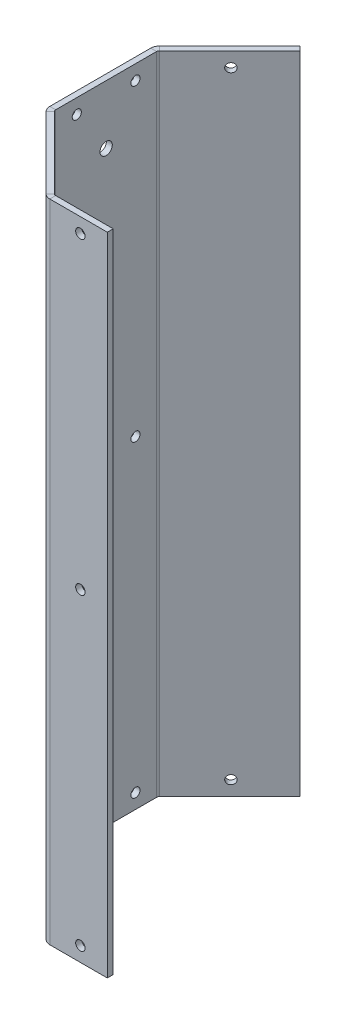
from build123d import *
from build123d.topology import SkipClean

# Parameters (mm, degrees)
EXTRUDE_1_DEPTH             = 220
SKETCH_3_R                  = 1.55
SKETCH_3_R_2                = 2.1
CUT_EXTRUDE_1_DEPTH         = 10
SKETCH_6_R                  = 1.6
CUT_EXTRUDE_2_DEPTH         = 10
CHAMFER_1_SIZE              = 1
CHAMFER_1_SIZE2             = 0.707106781
SHEET_START                 = -114.419250373
SHEET_METAL_2_OUTLINE_W     = 220
SHEET_METAL_2_OUTLINE_H     = 86.5
SHEET_METAL_2_OUTLINE_R     = 1.55
SHEET_METAL_2_OUTLINE_R_2   = 2.1
SHEET_METAL_2_DEPTH         = 26.274603255
SHEET_START_2               = -87.816219993
SHEET_METAL_2_2_OUTLINE_W   = 220
SHEET_METAL_2_2_OUTLINE_H   = 87
SHEET_METAL_2_2_OUTLINE_R   = 1.55
SHEET_METAL_2_2_OUTLINE_R_2 = 2.1
SHEET_METAL_2_2_DEPTH       = 0.483052927
SHEET_START_3               = -89.230433555
SHEET_METAL_2_3_OUTLINE_W   = 220
SHEET_METAL_2_3_OUTLINE_H   = 0.5
SHEET_METAL_2_3_DEPTH       = 21.707106781
SHEET_METAL_2_4_DEPTH       = 220
SHEET_METAL_2_5_DEPTH       = 220
SHEET_START_4               = 44
SHEET_METAL_2_6_OUTLINE_R   = 1.6
SHEET_METAL_2_6_DEPTH       = 0.5
SKETCH_7_R                  = 1.5
CUT_EXTRUDE_3_DEPTH         = 10


with BuildPart() as part:
    # 草图2 → 凸台-拉伸1 (new body)
    with BuildSketch(Plane(origin=(0, 0, 0), x_dir=(1, 0, 0), z_dir=(0, 1, 0))):
        Polygon((-87.523326774, 42.5), (-112.419250373, 17.604076401), (-112.419250373, -17.604076401), (-87.523326774, -42.5), (-67.523326774, -42.5), (-67.523326774, -44), (-88.144647118, -44), (-113.919250373, -18.225396744), (-113.919250373, 18.225396744), (-89.644647118, 42.5), align=None)
    extrude(amount=EXTRUDE_1_DEPTH)

    # Sketch 3 → 切除-拉伸1 (cut)
    with BuildSketch(Plane.ZY.offset(113.919250373)):
        with Locations((-10, 5)):
            Circle(SKETCH_3_R)
        with Locations((10, 5)):
            Circle(SKETCH_3_R)
        with BuildLine():
            ThreePointArc((-8.45, 110), (-10, 111.55), (-11.55, 110))
            Line((-11.55, 110), (-8.45, 110))
        make_face()
        with BuildLine():
            Line((-8.45, 110), (-11.55, 110))
            ThreePointArc((-11.55, 110), (-10, 108.45), (-8.45, 110))
        make_face()
        with BuildLine():
            ThreePointArc((8.45, 110), (10, 108.45), (11.55, 110))
            Line((11.55, 110), (8.45, 110))
        make_face()
        with BuildLine():
            Line((8.45, 110), (11.55, 110))
            ThreePointArc((11.55, 110), (10, 111.55), (8.45, 110))
        make_face()
        with Locations((-10, 215)):
            Circle(SKETCH_3_R)
        with Locations((10, 215)):
            Circle(SKETCH_3_R)
        with Locations((0, 200)):
            Circle(SKETCH_3_R_2)
        with Locations((0, 165)):
            Circle(SKETCH_3_R_2)
        with Locations((0, 55)):
            Circle(SKETCH_3_R_2)
        with Locations((0, 20)):
            Circle(SKETCH_3_R_2)
    extrude(amount=-CUT_EXTRUDE_1_DEPTH, mode=Mode.SUBTRACT)

    # 草图6 → 切除-拉伸2 (cut)
    with BuildSketch(Plane.XY.offset(44)):
        with Locations((-76.693326774, 5)):
            Circle(SKETCH_6_R)
        with Locations((-76.693326774, 110)):
            Circle(SKETCH_6_R)
        with Locations((-76.693326774, 215)):
            Circle(SKETCH_6_R)
    extrude(amount=-CUT_EXTRUDE_2_DEPTH, mode=Mode.SUBTRACT)

    # 倒角1
    chamfer_1_edges = [part.edges().sort_by_distance(p)[0] for p in [
        (-87.523326774, 110, -42.5),
    ]]
    chamfer_1_side = [part.faces().sort_by_distance(p)[0] for p in [
        (-99.971288574, 110, -30.0520382),
    ]]
    chamfer(chamfer_1_edges, length=CHAMFER_1_SIZE, length2=CHAMFER_1_SIZE2, reference=chamfer_1_side[0])

    # Sheet Metal 2: read off the stored shape, not the designer's step
    # Sheet Metal 2 outline → Sheet Metal 2 (add)
    with SkipClean():  # the faces are left unmerged after this step: merging them gives an invalid solid
        with BuildSketch(Plane.YZ.offset(SHEET_START)):
            with Locations((110, 0.75)):
                Rectangle(SHEET_METAL_2_OUTLINE_W, SHEET_METAL_2_OUTLINE_H)
            with Locations((5, -10)):
                Circle(SHEET_METAL_2_OUTLINE_R, mode=Mode.SUBTRACT)
            with Locations((20, 0)):
                Circle(SHEET_METAL_2_OUTLINE_R_2, mode=Mode.SUBTRACT)
            with Locations((55, 0)):
                Circle(SHEET_METAL_2_OUTLINE_R_2, mode=Mode.SUBTRACT)
            with Locations((110, -10)):
                Circle(SHEET_METAL_2_OUTLINE_R, mode=Mode.SUBTRACT)
            with Locations((215, -10)):
                Circle(SHEET_METAL_2_OUTLINE_R, mode=Mode.SUBTRACT)
            with Locations((165, 0)):
                Circle(SHEET_METAL_2_OUTLINE_R_2, mode=Mode.SUBTRACT)
            with Locations((200, 0)):
                Circle(SHEET_METAL_2_OUTLINE_R_2, mode=Mode.SUBTRACT)
            with Locations((5, 10)):
                Circle(SHEET_METAL_2_OUTLINE_R, mode=Mode.SUBTRACT)
            with Locations((110, 10)):
                Circle(SHEET_METAL_2_OUTLINE_R, mode=Mode.SUBTRACT)
            with Locations((215, 10)):
                Circle(SHEET_METAL_2_OUTLINE_R, mode=Mode.SUBTRACT)
        extrude(amount=SHEET_METAL_2_DEPTH)

    # Sheet Metal 2 2 outline → Sheet Metal 2 2 (add)
    with SkipClean():  # the faces are left unmerged after this step: merging them gives an invalid solid
        with BuildSketch(Plane.YZ.offset(SHEET_START_2)):
            with Locations((110, 1)):
                Rectangle(SHEET_METAL_2_2_OUTLINE_W, SHEET_METAL_2_2_OUTLINE_H)
            with Locations((5, -10)):
                Circle(SHEET_METAL_2_2_OUTLINE_R, mode=Mode.SUBTRACT)
            with Locations((20, 0)):
                Circle(SHEET_METAL_2_2_OUTLINE_R_2, mode=Mode.SUBTRACT)
            with Locations((55, 0)):
                Circle(SHEET_METAL_2_2_OUTLINE_R_2, mode=Mode.SUBTRACT)
            with Locations((110, -10)):
                Circle(SHEET_METAL_2_2_OUTLINE_R, mode=Mode.SUBTRACT)
            with Locations((215, -10)):
                Circle(SHEET_METAL_2_2_OUTLINE_R, mode=Mode.SUBTRACT)
            with Locations((165, 0)):
                Circle(SHEET_METAL_2_2_OUTLINE_R_2, mode=Mode.SUBTRACT)
            with Locations((200, 0)):
                Circle(SHEET_METAL_2_2_OUTLINE_R_2, mode=Mode.SUBTRACT)
            with Locations((5, 10)):
                Circle(SHEET_METAL_2_2_OUTLINE_R, mode=Mode.SUBTRACT)
            with Locations((110, 10)):
                Circle(SHEET_METAL_2_2_OUTLINE_R, mode=Mode.SUBTRACT)
            with Locations((215, 10)):
                Circle(SHEET_METAL_2_2_OUTLINE_R, mode=Mode.SUBTRACT)
        extrude(amount=SHEET_METAL_2_2_DEPTH)

    # Sheet Metal 2 3 outline → Sheet Metal 2 3 (add)
    with SkipClean():  # the faces are left unmerged after this step: merging them gives an invalid solid
        with BuildSketch(Plane.YZ.offset(SHEET_START_3)):
            with Locations((110, 44.25)):
                Rectangle(SHEET_METAL_2_3_OUTLINE_W, SHEET_METAL_2_3_OUTLINE_H)
        extrude(amount=SHEET_METAL_2_3_DEPTH)

    # Sheet Metal 2 4 outline → Sheet Metal 2 4 (cut)
    with BuildSketch(Plane(origin=(0, 0, 0), x_dir=(1, 0, 0), z_dir=(0, 1, 0))):
        with BuildLine():
            Line((-87.816219993, 42.5), (-87.816219993, -42.207106781))
            ThreePointArc((-87.816219993, -42.207106781), (-87.593520149, -42.374842797), (-87.333167066, -42.474576765))
            Line((-87.333167066, -42.474576765), (-87.333167066, 42.5))
            Line((-87.333167066, 42.5), (-87.816219993, 42.5))
        make_face()
        with BuildLine():
            Line((-88.144647118, 42.5), (-88.937540337, 42.5))
            Line((-88.937540337, 42.5), (-88.230433555, 41.792893219))
            Line((-88.230433555, 41.792893219), (-112.126357154, 17.89696962))
            ThreePointArc((-112.126357154, 17.89696962), (-112.343129906, 17.572546271), (-112.419250373, 17.189862838))
            Line((-112.419250373, 17.189862838), (-112.419250373, -17.189862838))
            ThreePointArc((-112.419250373, -17.189862838), (-112.343129906, -17.572546271), (-112.126357154, -17.89696962))
            Line((-112.126357154, -17.89696962), (-88.144647118, -41.878679656))
            Line((-88.144647118, -41.878679656), (-88.144647118, 42.5))
        make_face()
        with BuildLine():
            ThreePointArc((-113.540570717, -19.311183182), (-114.190888971, -18.337913135), (-114.419250373, -17.189862838))
            Line((-114.419250373, -17.189862838), (-114.419250373, -44))
            Line((-114.419250373, -44), (-89.230433555, -44))
            Line((-89.230433555, -44), (-89.230433555, -44.5))
            Line((-89.230433555, -44.5), (-87.109113212, -44.5))
            ThreePointArc((-87.109113212, -44.5), (-88.257163509, -44.271638598), (-89.230433555, -43.621320344))
            Line((-89.230433555, -43.621320344), (-113.540570717, -19.311183182))
        make_face()
        with BuildLine():
            Line((-113.540570717, 19.311183182), (-90.351753899, 42.5))
            Line((-90.351753899, 42.5), (-114.419250373, 42.5))
            Line((-114.419250373, 42.5), (-114.419250373, 17.189862838))
            ThreePointArc((-114.419250373, 17.189862838), (-114.190888971, 18.337913135), (-113.540570717, 19.311183182))
        make_face()
    extrude(amount=SHEET_METAL_2_4_DEPTH, mode=Mode.SUBTRACT)

    # Sheet Metal 2 5 outline → Sheet Metal 2 5 (add)
    with BuildSketch(Plane(origin=(0, 0, 0), x_dir=(1, 0, 0), z_dir=(0, 1, 0))):
        with BuildLine():
            ThreePointArc((-87.109113212, -42.5), (-87.221859022, -42.493623864), (-87.333167066, -42.474576765))
            Line((-87.333167066, -42.474576765), (-87.333167066, -42.5))
            Line((-87.333167066, -42.5), (-87.109113212, -42.5))
        make_face()
        Polygon((-88.937540337, 42.5), (-89.644647118, 43.207106781), (-90.351753899, 42.5), align=None)
    extrude(amount=SHEET_METAL_2_5_DEPTH)

    # Sheet Metal 2 6 outline → Sheet Metal 2 6 (cut)
    with BuildSketch(Plane.XY.offset(SHEET_START_4)):
        with Locations((-76.693326774, 5)):
            Circle(SHEET_METAL_2_6_OUTLINE_R)
        with Locations((-76.693326774, 110)):
            Circle(SHEET_METAL_2_6_OUTLINE_R)
        with Locations((-76.693326774, 215)):
            Circle(SHEET_METAL_2_6_OUTLINE_R)
    extrude(amount=SHEET_METAL_2_6_DEPTH, mode=Mode.SUBTRACT)

    # 草图7 → 切除-拉伸3 (cut)
    with BuildSketch(Plane(origin=(-66.425876949, 0, -66.425876949), x_dir=(-0.7071067811865474, 0, 0.7071067811865477), z_dir=(-0.7071067811865477, 0, -0.7071067811865474))):
        with Locations((49.436299673, 215)):
            Circle(SKETCH_7_R)
        with Locations((49.436299673, 5)):
            Circle(SKETCH_7_R)
    extrude(amount=-CUT_EXTRUDE_3_DEPTH, mode=Mode.SUBTRACT)


solid = part.part
